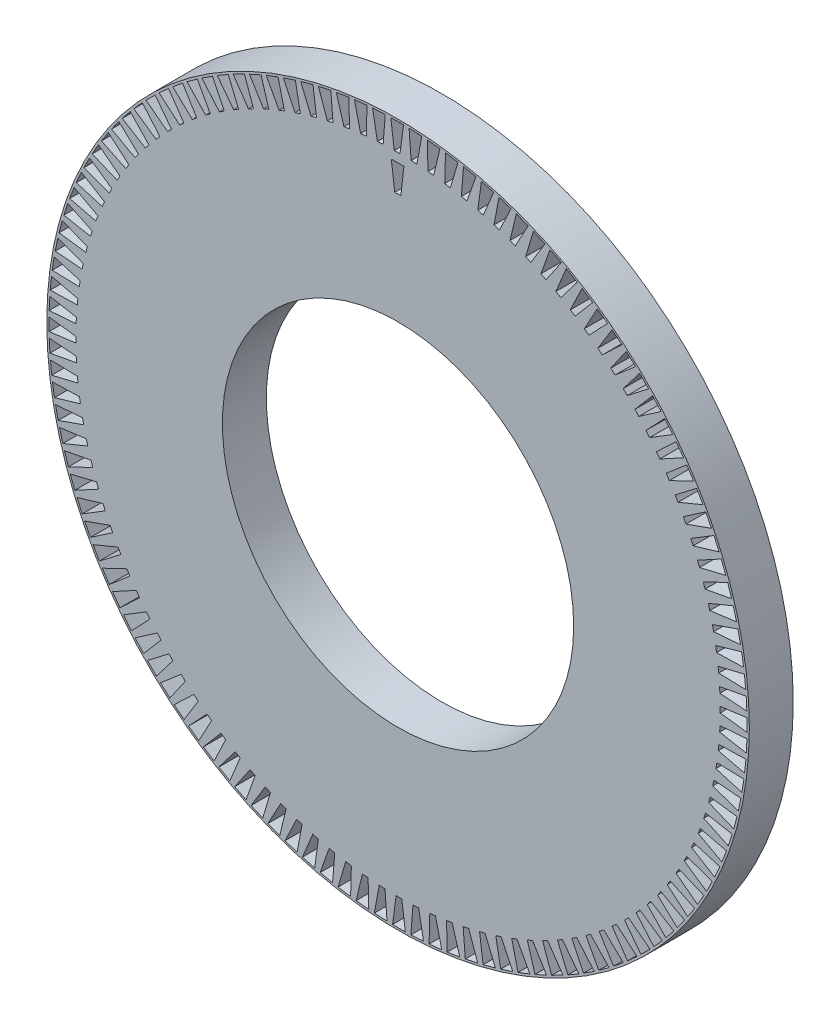
from build123d import *

# Parameters (mm, degrees)
SKETCH1_R           = 80
SKETCH1_R_2         = 40
BOSS_EXTRUDE1_DEPTH = 10
CUT_EXTRUDE1_DEPTH  = 10
CIRPATTERN1_COUNT   = 120
CUT_EXTRUDE2_DEPTH  = 10
SCALE1_SCALE        = 0.15


with BuildPart() as part:
    # Sketch1 → Boss-Extrude1 (new body)
    with BuildSketch(Plane.XY):
        Circle(SKETCH1_R)
        Circle(SKETCH1_R_2, mode=Mode.SUBTRACT)
    extrude(amount=BOSS_EXTRUDE1_DEPTH)

    # Sketch2 → Cut-Extrude1 (cut)
    with BuildSketch(Plane.XY.offset(10)):
        Polygon((-1.653504533, 79.478507469), (1.241878827, 79.478507469), (0.445002289, 73.369120677), (-0.856627995, 73.369120677), align=None)
    cut_extrude1 = extrude(amount=-CUT_EXTRUDE1_DEPTH, mode=Mode.SUBTRACT)

    # CirPattern1: Cut-Extrude1 ×120 about axis
    cirpattern1_axis = Axis((0, 0, 10), (0, 0, -1))
    for i in range(1, CIRPATTERN1_COUNT):
        add(cut_extrude1.rotate(cirpattern1_axis, i * 360 / CIRPATTERN1_COUNT), mode=Mode.SUBTRACT)

    # Sketch4 → Cut-Extrude2 (cut)
    with BuildSketch(Plane.XY.offset(10)):
        Polygon((1.338816605, 71.352737798), (0.640406859, 65.209913237), (-0.740844883, 65.19852217), (-1.540471455, 71.328992553), align=None)
    extrude(amount=-CUT_EXTRUDE2_DEPTH, mode=Mode.SUBTRACT)


with BuildPart() as part_1:
    # Scale1: scaled about (7.5852e-05, -0.066326361, 5)
    add(part.part.scale(SCALE1_SCALE).moved(Location((6.4474e-05, -0.056377407, 4.25))))


solid = part_1.part
